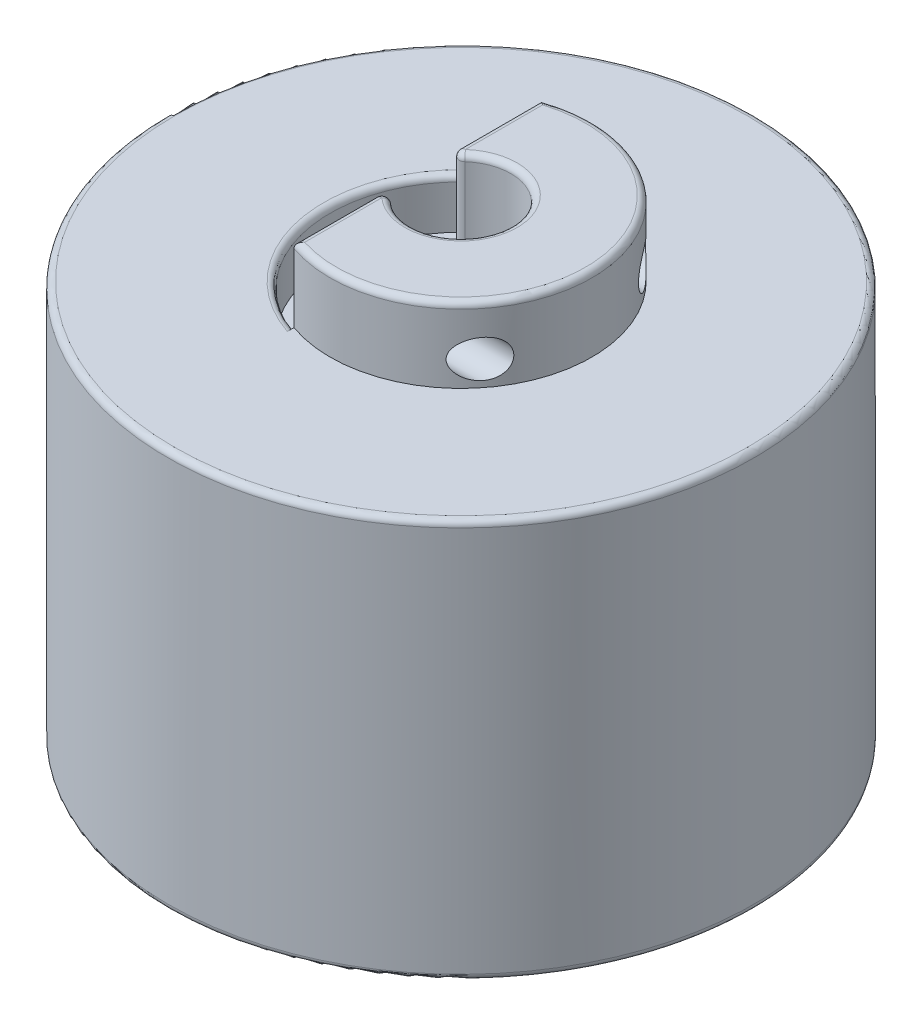
from build123d import *

# Parameters (mm, degrees)
ESQUISSE2_R             = 4
ENL_V_MAT_EXTRU_1_DEPTH = 20
ENL_V_MAT_EXTRU_2_DEPTH = 10
ESQUISSE5_R             = 1.5
ENL_V_MAT_EXTRU_3_DEPTH = 15
CONG_1_R                = 0.5
CONG_2_R                = 0.5


with BuildPart() as part:
    # Esquisse1 → Révolution1 (revolve)
    with BuildSketch(Plane.XY, mode=Mode.PRIVATE) as r_volution1_sk:
        Polygon((-19.5, 0), (-23.5, 0), (-23.5, 32), (-10.5, 32), (-10.5, 38), (0, 38), (0, 23), (-19.5, 23), align=None)
    revolve(r_volution1_sk.sketch.rotate(Axis((0, 0, 0), (0, 1, 0)), 270), axis=Axis((0, 0, 0), (0, 1, 0)))

    # Esquisse2 → Enlèv. mat.-Extru.1 (cut)
    with BuildSketch(Plane(origin=(0, 38, 0), x_dir=(1, 0, 0), z_dir=(0, 1, 0))):
        with Locations(Location((0, 0, 0), (0, 0, 270))):
            Circle(ESQUISSE2_R)
    extrude(amount=-ENL_V_MAT_EXTRU_1_DEPTH, mode=Mode.SUBTRACT)

    # Esquisse3 → Enlèv. mat.-Extru.2 (cut)
    with BuildSketch(Plane(origin=(0, 38, 0), x_dir=(1, 0, 0), z_dir=(0, 1, 0))):
        with BuildLine():
            Line((-3.5, 1.936491673), (-3.5, 9.899494937))
            ThreePointArc((-3.5, 9.899494937), (-10.5, 0), (-3.5, -9.899494937))
            Line((-3.5, -9.899494937), (-3.5, -1.936491673))
            ThreePointArc((-3.5, -1.936491673), (-4, 0), (-3.5, 1.936491673))
        make_face()
    extrude(amount=-ENL_V_MAT_EXTRU_2_DEPTH, mode=Mode.SUBTRACT)

    # Esquisse5 → Enlèv. mat.-Extru.3 (cut)
    with BuildSketch(Plane.ZY.offset(3.5)):
        with Locations((-6.5, 34)):
            Circle(ESQUISSE5_R)
        with Locations((6.5, 34)):
            Circle(ESQUISSE5_R)
    extrude(amount=-ENL_V_MAT_EXTRU_3_DEPTH, mode=Mode.SUBTRACT)

    # Congé1
    cong_1_edges = [part.edges().sort_by_distance(p)[0] for p in [
        (-3.5, 33, -1.936491673),
        (-3.5, 33, 1.936491673),
    ]]
    fillet(cong_1_edges, radius=CONG_1_R)

    # Congé2
    # the kernel refuses this fillet: 0.5 mm, written as the material it adds along each edge
    with BuildSketch(Plane(origin=(0, 23, 0), x_dir=(0, 0, -1), z_dir=(1, 0, 0))) as cong_2_piece_1:
        with BuildLine():
            CenterArc((19.5 - CONG_2_R, -CONG_2_R), CONG_2_R, 0, 90)
            Line((19.5 - CONG_2_R, 0), (19.5, 0))
            Line((19.5, 0), (19.5, -CONG_2_R))
        make_face()
    revolve(axis=Axis((0, 23, 0), (0, 1, 0)))
    # the kernel refuses this fillet: 0.5 mm, written as the material it takes off along each edge
    with BuildSketch(Plane(origin=(0, 23, 0), x_dir=(0, 0, 1), z_dir=(-1, 0, 0))) as cong_2_2_piece_1:
        with BuildLine():
            CenterArc((4 + CONG_2_R, CONG_2_R), CONG_2_R, 180, 90)
            Line((4 + CONG_2_R, 0), (4, 0))
            Line((4, 0), (4, CONG_2_R))
        make_face()
    revolve(axis=Axis((0, 23, 0), (0, 1, 0)), mode=Mode.SUBTRACT)
    with BuildSketch(Plane(origin=(0, 38, 0), x_dir=(-0.4432023779000481, 0, -0.8964215817480875), z_dir=(-0.8964215817480875, 0, 0.4432023779000481))) as cong_2_2_piece_2:
        with BuildLine():
            CenterArc((10.5 - CONG_2_R, CONG_2_R), CONG_2_R, 270, 90)
            Line((10.5, CONG_2_R), (10.5, 0))
            Line((10.5, 0), (10.5 - CONG_2_R, 0))
        make_face()
    revolve(axis=Axis((0, 38, 0), (0, -1, 0)), revolution_arc=232.616769328, mode=Mode.SUBTRACT)
    with BuildSketch(Plane(origin=(-3.5, 38, -3.354101966), x_dir=(1, 0, 0), z_dir=(0, 0, -1)), Plane(origin=(-3.5, 38, 11.149494937), x_dir=(1, 0, 0), z_dir=(0, 0, -1))) as cong_2_2_piece_3:
        with BuildLine():
            CenterArc((CONG_2_R, CONG_2_R), CONG_2_R, 180, 90)
            Line((0, CONG_2_R), (0, 0))
            Line((0, 0), (CONG_2_R, 0))
        make_face()
    extrude(amount=7.79539297, mode=Mode.SUBTRACT)
    with BuildSketch(Plane(origin=(0, 38, 0), x_dir=(0, 0, 1), z_dir=(-1, 0, 0))) as cong_2_2_piece_4:
        with BuildLine():
            CenterArc((4 + CONG_2_R, -CONG_2_R), CONG_2_R, 90, 90)
            Line((4 + CONG_2_R, 0), (4, 0))
            Line((4, 0), (4, -CONG_2_R))
        make_face()
    revolve(axis=Axis((0, 38, 0), (0, 1, 0)), revolution_arc=221.810314896, mode=Mode.SUBTRACT)
    with BuildSketch(Plane(origin=(-3, 38, -3.354101966), x_dir=(0.6666666666666691, 0, 0.7453559924999279), z_dir=(0.7453559924999279, 0, -0.6666666666666691))) as cong_2_2_piece_5:
        with BuildLine():
            CenterArc((0.5 - CONG_2_R, CONG_2_R), CONG_2_R, 270, 90)
            Line((0.5, CONG_2_R), (0.5, 0))
            Line((0.5, 0), (0.5 - CONG_2_R, 0))
        make_face()
    revolve(axis=Axis((-3, 38, -3.354101966), (0, -1, 0)), revolution_arc=131.810314896, mode=Mode.SUBTRACT)
    with BuildSketch(Plane(origin=(-3, 38, 3.354101966), x_dir=(0.6666666666666634, 0, -0.7453559924999329), z_dir=(0.7453559924999329, 0, 0.6666666666666634))) as cong_2_2_piece_6:
        with BuildLine():
            CenterArc((0.5 - CONG_2_R, -CONG_2_R), CONG_2_R, 0, 90)
            Line((0.5, -CONG_2_R), (0.5, 0))
            Line((0.5, 0), (0.5 - CONG_2_R, 0))
        make_face()
    revolve(axis=Axis((-3, 38, 3.354101966), (0, 1, 0)), revolution_arc=131.810314896, mode=Mode.SUBTRACT)
    with BuildSketch(Plane(origin=(0, 0, 0), x_dir=(0, 0, -1), z_dir=(1, 0, 0))) as cong_2_2_piece_7:
        with BuildLine():
            CenterArc((23.5 - CONG_2_R, CONG_2_R), CONG_2_R, 270, 90)
            Line((23.5 - CONG_2_R, 0), (23.5, 0))
            Line((23.5, 0), (23.5, CONG_2_R))
        make_face()
    revolve(axis=Axis((0, 0, 0), (0, 1, 0)), mode=Mode.SUBTRACT)
    with BuildSketch(Plane(origin=(0, 0, 0), x_dir=(0, 0, -1), z_dir=(1, 0, 0))) as cong_2_2_piece_8:
        with BuildLine():
            CenterArc((19.5 + CONG_2_R, CONG_2_R), CONG_2_R, 180, 90)
            Line((19.5 + CONG_2_R, 0), (19.5, 0))
            Line((19.5, 0), (19.5, CONG_2_R))
        make_face()
    revolve(axis=Axis((0, 0, 0), (0, 1, 0)), mode=Mode.SUBTRACT)
    with BuildSketch(Plane(origin=(0, 32, 0), x_dir=(-0.21888515145159862, 0, -0.9757506292460234), z_dir=(0.9757506292460234, 0, -0.21888515145159862))) as cong_2_2_piece_9_section:
        with BuildLine():
            CenterArc((10.5 + CONG_2_R, -CONG_2_R), CONG_2_R, 90, 90)
            Line((10.5 + CONG_2_R, 0), (10.5, 0))
            Line((10.5, 0), (10.5, -CONG_2_R))
        make_face()
    cong_2_2_piece_9 = revolve(axis=Axis((0, 32, 0), (0, 1, 0)), revolution_arc=154.712877956, mode=Mode.PRIVATE)
    cong_2_2_piece_9 = split(cong_2_2_piece_9, bisect_by=Plane(origin=(-3.5, 31.86147473, 0), z_dir=(-1, 0, 0)), keep=Keep.TOP, mode=Mode.PRIVATE)
    add(cong_2_2_piece_9, mode=Mode.SUBTRACT)
    with BuildSketch(Plane(origin=(0, 32, 0), x_dir=(0, 0, -1), z_dir=(1, 0, 0))) as cong_2_2_piece_10:
        with BuildLine():
            CenterArc((23.5 - CONG_2_R, -CONG_2_R), CONG_2_R, 0, 90)
            Line((23.5, -CONG_2_R), (23.5, 0))
            Line((23.5, 0), (23.5 - CONG_2_R, 0))
        make_face()
    revolve(axis=Axis((0, 32, 0), (0, 1, 0)), mode=Mode.SUBTRACT)
    with BuildSketch(Plane(origin=(0, 38, 0), x_dir=(-0.6666666666666664, 0, 0.7453559924999301), z_dir=(-0.7453559924999301, 0, -0.6666666666666664))) as cong_2_2_piece_11:
        with BuildLine():
            CenterArc((4 + CONG_2_R, -CONG_2_R), CONG_2_R, 90, 90)
            Line((4 + CONG_2_R, 0), (4, 0))
            Line((4, 0), (4, -CONG_2_R))
        make_face()
    revolve(axis=Axis((0, 38, 0), (0, 1, 0)), revolution_arc=41.810314896, mode=Mode.SUBTRACT)


solid = part.part
